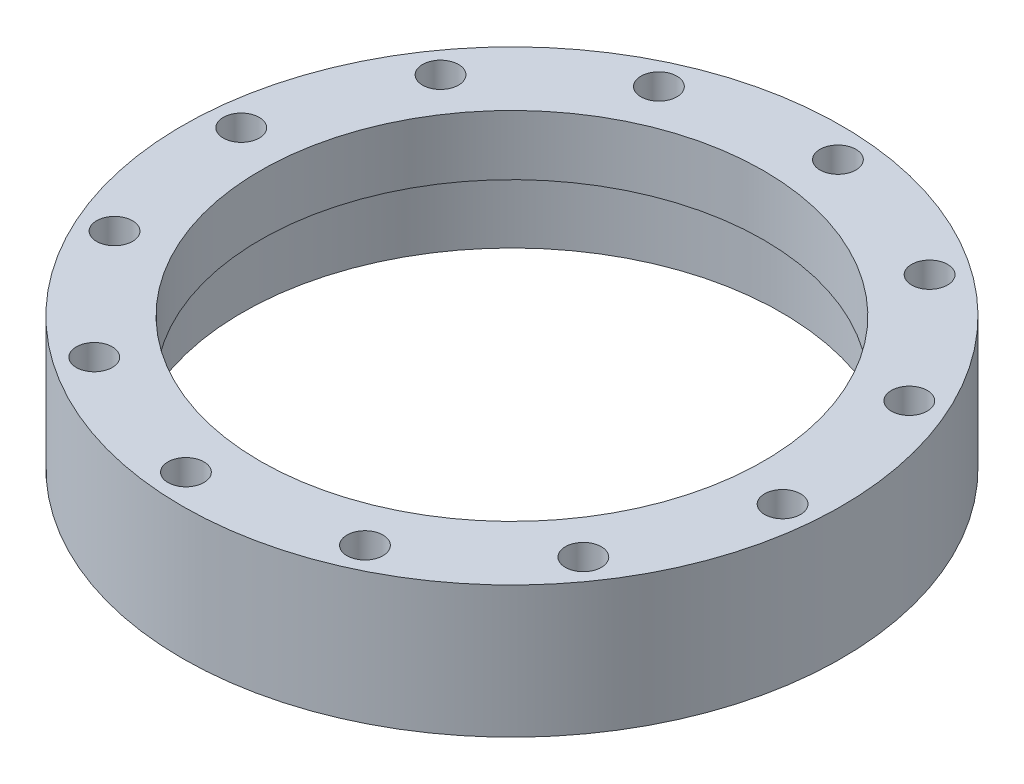
from build123d import *

# Parameters (mm, degrees)
SKETCH1_R           = 27.5
SKETCH1_R_2         = 22.5
SKETCH1_R_3         = 1.5
BOSS_EXTRUDE1_DEPTH = 11
BOSS_EXTRUDE2_START = -5
SKETCH2_R           = 22.5
SKETCH2_R_2         = 21
BOSS_EXTRUDE2_DEPTH = 5


with BuildPart() as part:
    # Sketch1 → Boss-Extrude1 (new body)
    with BuildSketch(Plane(origin=(0, 0, 0), x_dir=(1, 0, 0), z_dir=(0, 1, 0))):
        Circle(SKETCH1_R)
        Circle(SKETCH1_R_2, mode=Mode.SUBTRACT)
        with Locations((2.308641256, 24.893175281)):
            Circle(SKETCH1_R_3, mode=Mode.SUBTRACT)
        with Locations((14.445929616, 20.403801546)):
            Circle(SKETCH1_R_3, mode=Mode.SUBTRACT)
        with Locations((22.712442802, 10.447245665)):
            Circle(SKETCH1_R_3, mode=Mode.SUBTRACT)
        with Locations((24.893175281, -2.308641256)):
            Circle(SKETCH1_R_3, mode=Mode.SUBTRACT)
        with Locations((20.403801546, -14.445929616)):
            Circle(SKETCH1_R_3, mode=Mode.SUBTRACT)
        with Locations((10.447245665, -22.712442802)):
            Circle(SKETCH1_R_3, mode=Mode.SUBTRACT)
        with Locations((-2.308641256, -24.893175281)):
            Circle(SKETCH1_R_3, mode=Mode.SUBTRACT)
        with Locations((-14.445929616, -20.403801546)):
            Circle(SKETCH1_R_3, mode=Mode.SUBTRACT)
        with Locations((-22.712442802, -10.447245665)):
            Circle(SKETCH1_R_3, mode=Mode.SUBTRACT)
        with Locations((-24.893175281, 2.308641256)):
            Circle(SKETCH1_R_3, mode=Mode.SUBTRACT)
        with Locations((-20.403801546, 14.445929616)):
            Circle(SKETCH1_R_3, mode=Mode.SUBTRACT)
        with Locations((-10.447245665, 22.712442802)):
            Circle(SKETCH1_R_3, mode=Mode.SUBTRACT)
    extrude(amount=BOSS_EXTRUDE1_DEPTH)

    # Sketch2 → Boss-Extrude2 (add)
    with BuildSketch(Plane(origin=(0, 11, 0), x_dir=(1, 0, 0), z_dir=(0, 1, 0)).offset(BOSS_EXTRUDE2_START)):
        Circle(SKETCH2_R)
        Circle(SKETCH2_R_2, mode=Mode.SUBTRACT)
    extrude(amount=BOSS_EXTRUDE2_DEPTH)


solid = part.part
